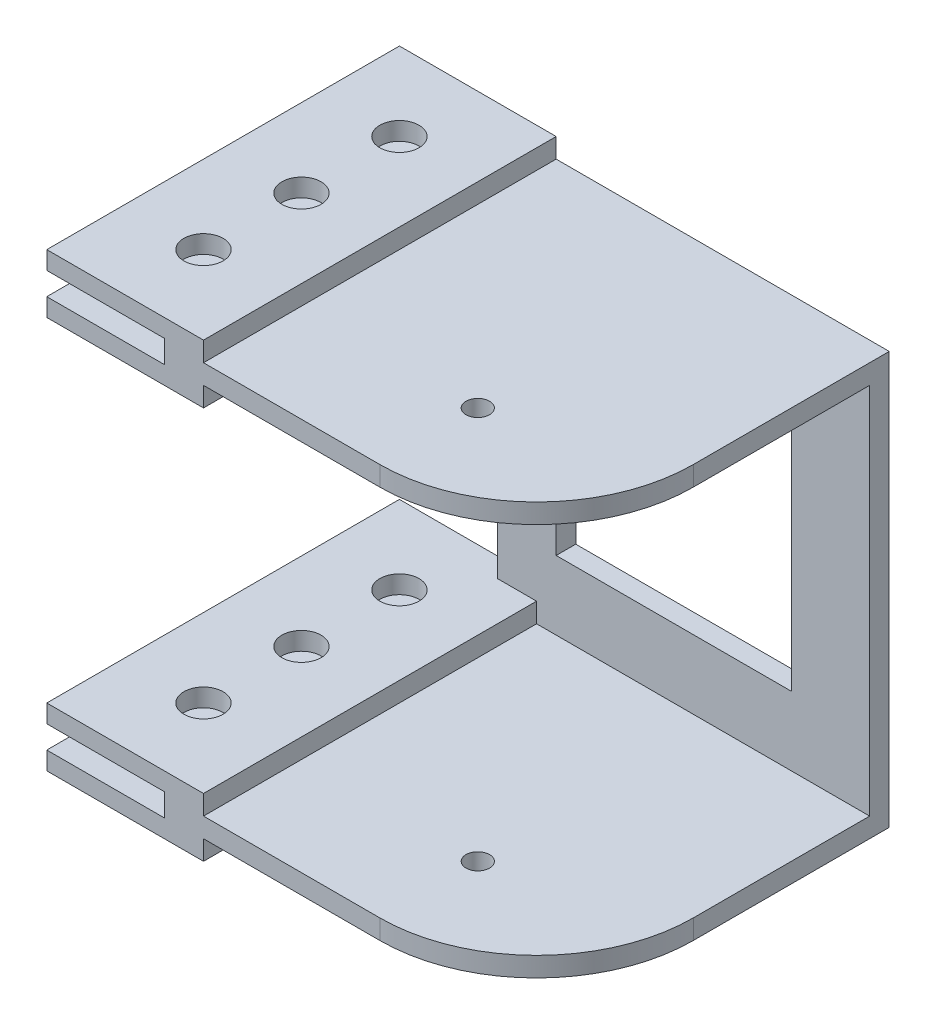
from build123d import *

# Parameters (mm, degrees)
EXTRUDE_1_DEPTH     = 5
EXTRUDE_2_DEPTH     = 85
SKETCH_2_R          = 3
CUT_EXTRUDE_1_DEPTH = 144
FILLET_1_R          = 40
SKETCH_4_W          = 30
SKETCH_4_H          = 5.8
CUT_EXTRUDE_2_DEPTH = 144
SKETCH_5_W          = 60
SKETCH_5_H          = 60
CUT_EXTRUDE_3_DEPTH = 144
SKETCH_6_R          = 5
CUT_EXTRUDE_4_DEPTH = 144


with BuildPart() as part:
    # 스케치1 → 보스-돌출1 (new body)
    with BuildSketch(Plane.XY):
        Polygon((0, -42.6), (-30, -42.6), (-30, -47.6), (0, -47.6), (0, -52.6), (-30, -52.6), (-30, -57.6), (10, -57.6), (10, -52.6), (95, -52.6), (95, 52.6), (10, 52.6), (10, 57.6), (-30, 57.6), (-30, 52.6), (0, 52.6), (0, 47.6), (-30, 47.6), (-30, 42.6), (0, 42.6), align=None)
    extrude(amount=-EXTRUDE_1_DEPTH)

    # 스케치1<3> → 보스-돌출2 (add)
    with BuildSketch(Plane.XY):
        Polygon((10, -47.6), (10, -42.6), (-30, -42.6), (-30, -47.6), (0, -47.6), (0, -52.6), (-30, -52.6), (-30, -57.6), (10, -57.6), (10, -52.6), (95, -52.6), (95, -47.6), align=None)
        Polygon((-30, 42.6), (10, 42.6), (10, 47.6), (95, 47.6), (95, 52.6), (10, 52.6), (10, 57.6), (-30, 57.6), (-30, 52.6), (0, 52.6), (0, 47.6), (-30, 47.6), align=None)
    extrude(amount=EXTRUDE_2_DEPTH)

    # 스케치2 → 컷-돌출1 (cut)
    with BuildSketch(Plane.XZ.offset(52.6)):
        with Locations((55, 60)):
            Circle(SKETCH_2_R)
    extrude(amount=-CUT_EXTRUDE_1_DEPTH, mode=Mode.SUBTRACT)

    # 필렛1
    fillet_1_edges = [part.edges().sort_by_distance(p)[0] for p in [
        (95, 50.1, 85),
        (95, -50.1, 85),
    ]]
    fillet(fillet_1_edges, radius=FILLET_1_R)

    # 스케치4 → 컷-돌출2 (cut)
    with BuildSketch(Plane.XY.offset(85)):
        with Locations((-15, -50.1)):
            Rectangle(SKETCH_4_W, SKETCH_4_H)
        with Locations((-15, 50.1)):
            Rectangle(SKETCH_4_W, SKETCH_4_H)
    extrude(amount=-CUT_EXTRUDE_2_DEPTH, mode=Mode.SUBTRACT)

    # 스케치5 → 컷-돌출3 (cut)
    with BuildSketch(Plane.XY):
        with Locations((45, 0)):
            Rectangle(SKETCH_5_W, SKETCH_5_H)
    extrude(amount=-CUT_EXTRUDE_3_DEPTH, mode=Mode.SUBTRACT)

    # 스케치6 → 컷-돌출4 (cut)
    with BuildSketch(Plane.XZ.offset(57.6)):
        with Locations((-10, 40)):
            Circle(SKETCH_6_R)
        with Locations((-10, 65)):
            Circle(SKETCH_6_R)
        with Locations((-10, 15)):
            Circle(SKETCH_6_R)
    extrude(amount=-CUT_EXTRUDE_4_DEPTH, mode=Mode.SUBTRACT)


solid = part.part
